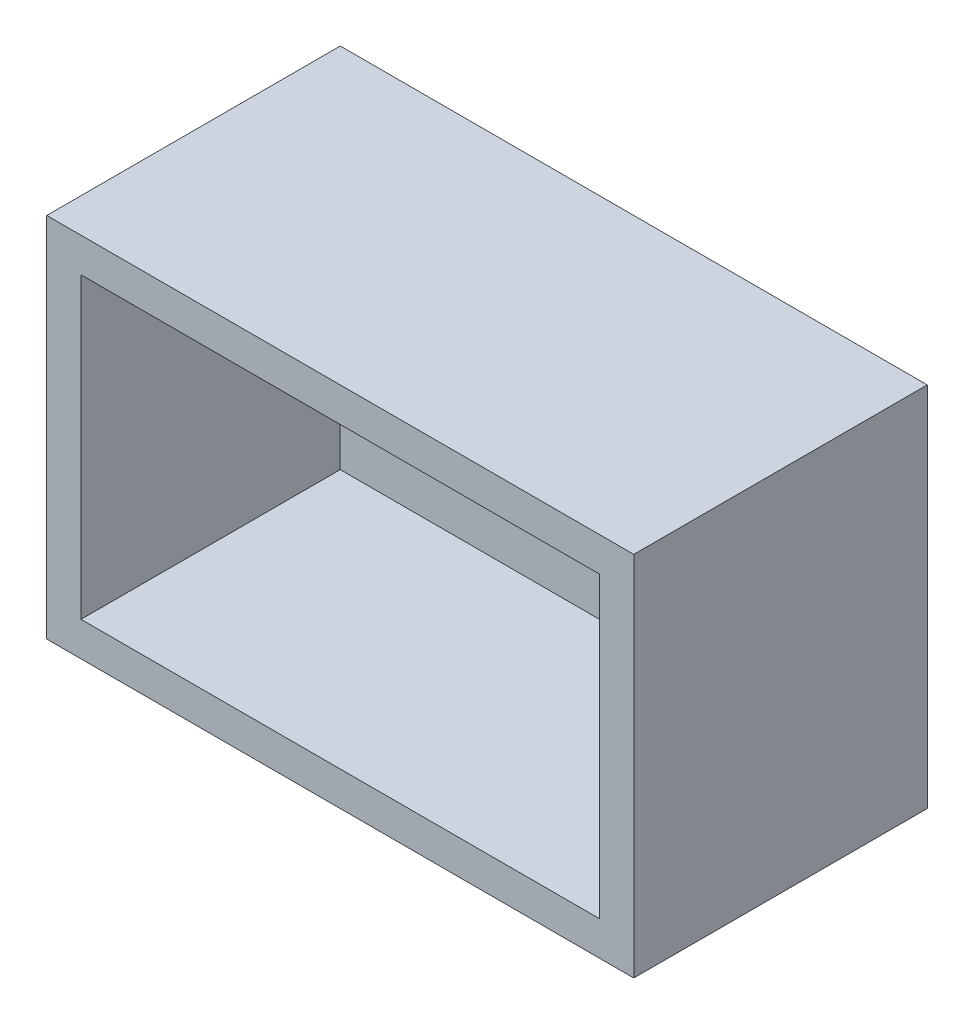
from build123d import *

# Parameters (mm, degrees)
SKICA1_W                 = 120
SKICA1_H                 = 75
P_IDAT_VYSUNUT_M9_DEPTH  = 7
SKICA9_W                 = 60
SKICA9_H                 = 75
P_IDAT_VYSUNUT_M10_DEPTH = 7
SKICA10_W                = 60
SKICA10_H                = 75
P_IDAT_VYSUNUT_M11_DEPTH = 7
SKICA11_W                = 120
SKICA11_H                = 60
P_IDAT_VYSUNUT_M12_DEPTH = 7
SKICA12_W                = 120
SKICA12_H                = 60
P_IDAT_VYSUNUT_M13_DEPTH = 7


with BuildPart() as part:
    # Skica1 → Přidat vysunutím9 (new body)
    with BuildSketch(Plane.XY):
        Rectangle(SKICA1_W, SKICA1_H)
    extrude(amount=P_IDAT_VYSUNUT_M9_DEPTH)

    # Skica9 → Přidat vysunutím10 (add)
    with BuildSketch(Plane.ZY.offset(60)):
        with Locations((30, 0)):
            Rectangle(SKICA9_W, SKICA9_H)
    extrude(amount=-P_IDAT_VYSUNUT_M10_DEPTH)

    # Skica10 → Přidat vysunutím11 (add)
    with BuildSketch(Plane(origin=(60, 0, 0), x_dir=(0, 0, -1), z_dir=(1, 0, 0))):
        with Locations((-30, 0)):
            Rectangle(SKICA10_W, SKICA10_H)
    extrude(amount=-P_IDAT_VYSUNUT_M11_DEPTH)

    # Skica11 → Přidat vysunutím12 (add)
    with BuildSketch(Plane(origin=(0, -37.5, 0), x_dir=(-1, 0, 0), z_dir=(0, -1, 0))):
        with Locations((0, -30)):
            Rectangle(SKICA11_W, SKICA11_H)
    extrude(amount=-P_IDAT_VYSUNUT_M12_DEPTH)

    # Skica12 → Přidat vysunutím13 (add)
    with BuildSketch(Plane(origin=(0, 37.5, 0), x_dir=(1, 0, 0), z_dir=(0, 1, 0))):
        with Locations((0, -30)):
            Rectangle(SKICA12_W, SKICA12_H)
    extrude(amount=-P_IDAT_VYSUNUT_M13_DEPTH)


solid = part.part
